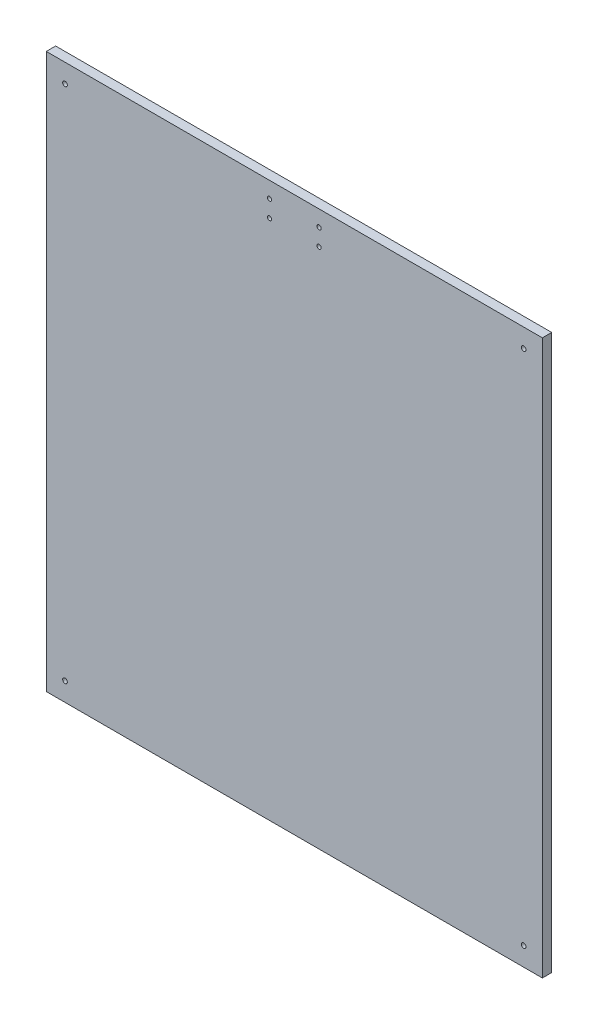
from build123d import *

# Parameters (mm, degrees)
SKETCH_3_W                  = 530
SKETCH_3_H                  = 592.3
EXTRUDE_1_DEPTH             = 10
SKETCH_4_R                  = 2.5
CUT_EXTRUDE_1_DEPTH         = 398.529649838
PATTERN_LINEAR_1_COUNT      = 2
PATTERN_LINEAR_1_PITCH      = 490
PATTERN_LINEAR_1_COUNT_DIR2 = 2
PATTERN_LINEAR_1_PITCH_DIR2 = 552.3
SKETCH_7_R                  = 2.25
CUT_EXTRUDE_2_DEPTH         = 398.529649838


with BuildPart() as part:
    # Эскиз3 → Бобышка-Вытянуть1 (new body)
    with BuildSketch(Plane.XY):
        Rectangle(SKETCH_3_W, SKETCH_3_H)
    extrude(amount=EXTRUDE_1_DEPTH)

    # Эскиз4 → Вырез-Вытянуть1 (cut, through all)
    with BuildSketch(Plane.XY.offset(10)):
        with Locations((-245, 276.15)):
            Circle(SKETCH_4_R)
    cut_extrude_1 = extrude(amount=-CUT_EXTRUDE_1_DEPTH, mode=Mode.SUBTRACT)

    # Линейный массив1: Cut-Extrude 1 2 × 2
    with Locations(*[(i * PATTERN_LINEAR_1_PITCH, -j * PATTERN_LINEAR_1_PITCH_DIR2, 0) for i in range(PATTERN_LINEAR_1_COUNT) for j in range(PATTERN_LINEAR_1_COUNT_DIR2) if (i, j) != (0, 0)]):
        add(cut_extrude_1, mode=Mode.SUBTRACT)

    # Эскиз7 → Вырез-Вытянуть2 (cut, through all)
    with BuildSketch(Plane(origin=(0, 0, 0), x_dir=(-1, 0, 0), z_dir=(0, 0, -1))):
        with Locations((-26.5, 279.15)):
            Circle(SKETCH_7_R)
        with Locations((26.5, 279.15)):
            Circle(SKETCH_7_R)
        with Locations((-26.5, 261.15)):
            Circle(SKETCH_7_R)
        with Locations((26.5, 261.15)):
            Circle(SKETCH_7_R)
    extrude(amount=-CUT_EXTRUDE_2_DEPTH, mode=Mode.SUBTRACT)


solid = part.part
